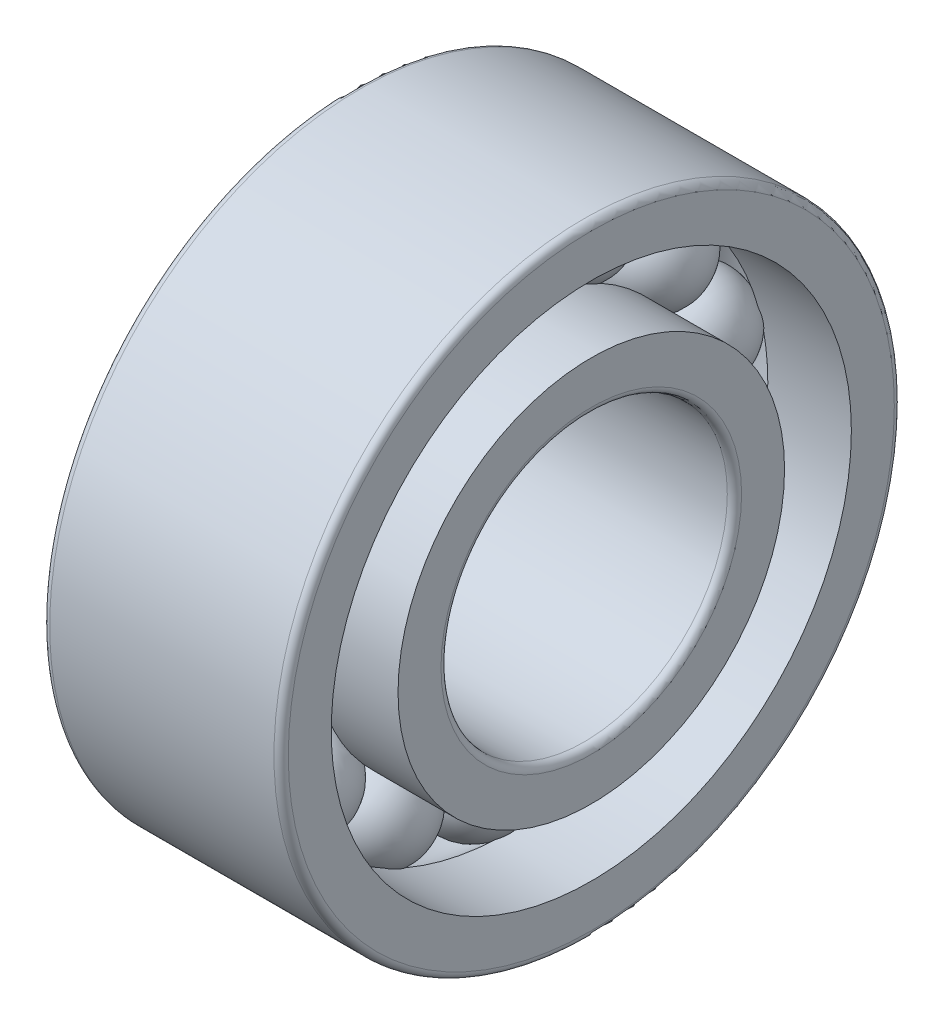
from build123d import *

# Parameters (mm, degrees)
CAGSPISKE_W         = 0.21
CAGSPISKE_H         = 0.35
CAGESPINE_ANGLE     = 0.001
BALLSDETAILED_COUNT = 14
BALLSDETAILED_ANGLE = 334.285714286


with BuildPart() as part:
    # CagSpiSke → CageSpine (revolve)
    with BuildSketch(Plane.XY):
        with Locations((0, 4.75)):
            Rectangle(CAGSPISKE_W, CAGSPISKE_H)
    revolve(axis=Axis((-20.6375, 0, 0), (1, 0, 0)), revolution_arc=CAGESPINE_ANGLE)

    # BalDetSke → BallDetailed (revolve)
    with BuildSketch(Plane.XY):
        with BuildLine():
            Line((-1.05, 4.75), (1.05, 4.75))
            ThreePointArc((1.05, 4.75), (0, 3.7), (-1.05, 4.75))
        make_face()
    balldetailed = revolve(axis=Axis((-1.905, 4.75, 0), (1, 0, 0)))

    # InnRacSke → InnerRace (revolve)
    with BuildSketch(Plane.XY):
        with BuildLine():
            Line((-0.748748957, 4.05), (-2.5, 4.05))
            Line((-2.5, 4.05), (-2.5, 3.15))
            ThreePointArc((-2.5, 3.15), (-2.456066017, 3.043933983), (-2.35, 3))
            Line((-2.35, 3), (2.35, 3))
            ThreePointArc((2.35, 3), (2.456066017, 3.043933983), (2.5, 3.15))
            Line((2.5, 3.15), (2.5, 4.05))
            Line((2.5, 4.05), (0.748748957, 4.05))
            ThreePointArc((0.748748957, 4.05), (0, 3.725), (-0.748748957, 4.05))
        make_face()
    revolve(axis=Axis((-20.6375, 0, 0), (1, 0, 0)))

    # OutRacSke → OuterRace (revolve)
    with BuildSketch(Plane.XY):
        with BuildLine():
            Line((-0.748748957, 5.45), (-2.5, 5.45))
            Line((-2.5, 5.45), (-2.5, 6.35))
            ThreePointArc((-2.5, 6.35), (-2.456066017, 6.456066017), (-2.35, 6.5))
            Line((-2.35, 6.5), (2.35, 6.5))
            ThreePointArc((2.35, 6.5), (2.456066017, 6.456066017), (2.5, 6.35))
            Line((2.5, 6.35), (2.5, 5.45))
            Line((2.5, 5.45), (0.748748957, 5.45))
            ThreePointArc((0.748748957, 5.45), (0, 5.775), (-0.748748957, 5.45))
        make_face()
    revolve(axis=Axis((-20.6375, 0, 0), (1, 0, 0)))

    # BallsDetailed: BallDetailed ×14 about axis
    ballsdetailed_axis = Axis((-50, 0, 0), (1, 0, 0))
    for i in range(1, BALLSDETAILED_COUNT):
        add(balldetailed.rotate(ballsdetailed_axis, i * BALLSDETAILED_ANGLE / (BALLSDETAILED_COUNT - 1)))


solid = part.part
